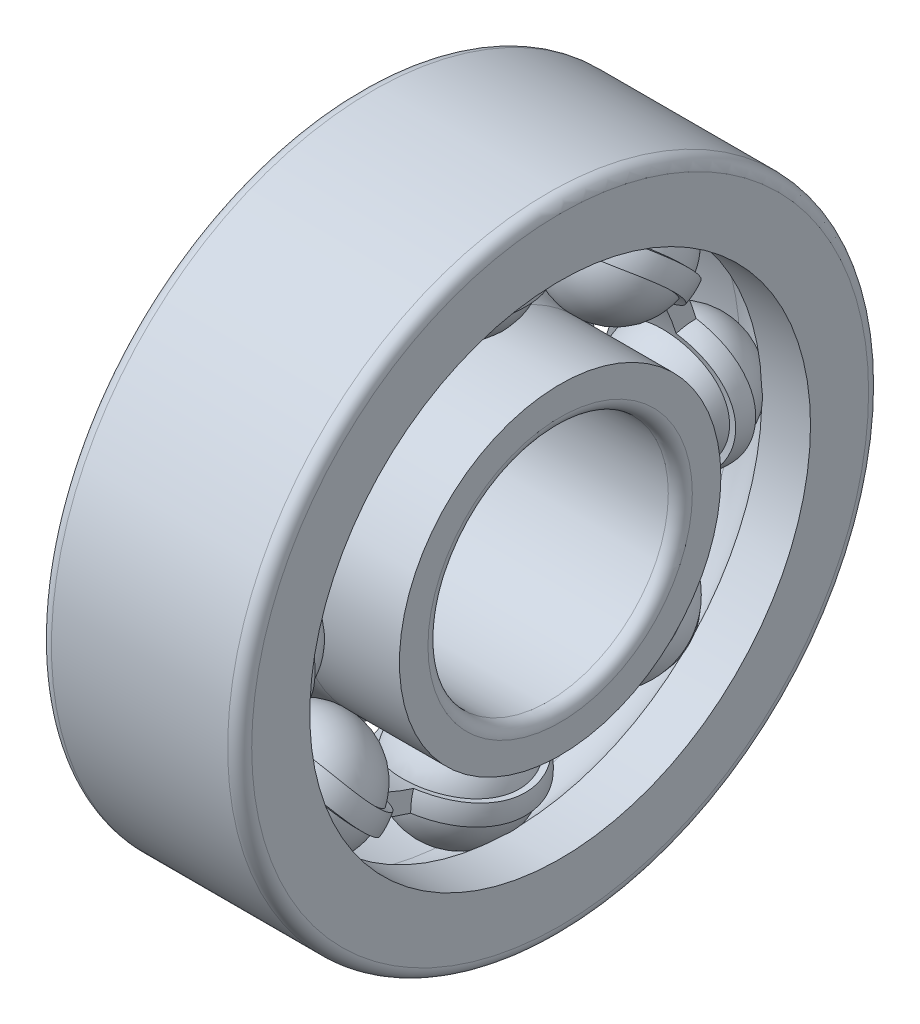
from build123d import *
from build123d.topology import SkipClean

# Parameters (mm, degrees)
CAGSPISKE_W          = 1.5
CAGSPISKE_H          = 1
CAGEBALLS_COUNT      = 8
CAGEBALLS_ANGLE      = 315
CAGTRMODSKE_W        = 6.602
CAGTRMODSKE_H        = 2.801
CAGETRIMID_START     = -3.3
CAGETRIMID_OUTLINE_R = 10.5
CAGETRIMID_DEPTH     = 6.6
BALLSDETAILED_COUNT  = 8
BALLSDETAILED_ANGLE  = 315


with BuildPart() as part:
    # CagSpiSke → CageSpine (revolve)
    with BuildSketch(Plane.XY, mode=Mode.PRIVATE) as cagespine_sk:
        with Locations((0, 11)):
            Rectangle(CAGSPISKE_W, CAGSPISKE_H)
    revolve(cagespine_sk.sketch.rotate(Axis((-20.6375, 0, 0), (1, 0, 0)), 90), axis=Axis((-20.6375, 0, 0), (1, 0, 0)))

    # CagBalSke → CageBall (revolve)
    with BuildSketch(Plane.XY):
        with BuildLine():
            Line((-3.3, 11), (3.3, 11))
            ThreePointArc((3.3, 11), (0, 7.7), (-3.3, 11))
        make_face()
    cageball = revolve(axis=Axis((-1.905, 11, 0), (1, 0, 0)))

    # CageBalls: CageBall ×8 about axis
    cageballs_axis = Axis((-50, 0, 0), (1, 0, 0))
    for i in range(1, CAGEBALLS_COUNT):
        add(cageball.rotate(cageballs_axis, i * CAGEBALLS_ANGLE / (CAGEBALLS_COUNT - 1)))

    # CagTrmODSke → CageTrimOD (revolve, cut)
    with SkipClean():  # the faces are left unmerged after this step: merging them gives an invalid solid
        with BuildSketch(Plane.XY, mode=Mode.PRIVATE) as cagetrimod_sk:
            with Locations((0, 12.9005)):
                Rectangle(CAGTRMODSKE_W, CAGTRMODSKE_H)
        revolve(cagetrimod_sk.sketch.rotate(Axis((-20.6375, 0, 0), (1, 0, 0)), 73.774204952), axis=Axis((-20.6375, 0, 0), (1, 0, 0)), mode=Mode.SUBTRACT)

    # CageTrimID: read off the stored shape, not the designer's step
    # CageTrimID outline → CageTrimID (cut)
    with SkipClean():  # the faces are left unmerged after this step: merging them gives an invalid solid
        with BuildSketch(Plane.YZ.offset(CAGETRIMID_START)):
            Circle(CAGETRIMID_OUTLINE_R)
        extrude(amount=CAGETRIMID_DEPTH, mode=Mode.SUBTRACT)

    # BalDetSke → BallDetailed (revolve)
    with SkipClean():  # the faces are left unmerged after this step: merging them gives an invalid solid
        with BuildSketch(Plane.XY):
            with BuildLine():
                Line((-3, 11), (3, 11))
                ThreePointArc((3, 11), (0, 8), (-3, 11))
            make_face()
        balldetailed = revolve(axis=Axis((-1.905, 11, 0), (1, 0, 0)))

    # InnRacSke → InnerRace (revolve)
    with SkipClean():  # the faces are left unmerged after this step: merging them gives an invalid solid
        with BuildSketch(Plane.XY, mode=Mode.PRIVATE) as innerrace_sk:
            with BuildLine():
                Line((-2.569168153, 9.5), (-5, 9.5))
                Line((-5, 9.5), (-5, 6.6))
                ThreePointArc((-5, 6.6), (-4.824264069, 6.175735931), (-4.4, 6))
                Line((-4.4, 6), (4.4, 6))
                ThreePointArc((4.4, 6), (4.824264069, 6.175735931), (5, 6.6))
                Line((5, 6.6), (5, 8.025))
                Line((5, 8.025), (0, 8.025))
                ThreePointArc((0, 8.025), (-1.481236814, 8.419968508), (-2.569168153, 9.5))
            make_face()
        revolve(innerrace_sk.sketch.rotate(Axis((-20.6375, 0, 0), (1, 0, 0)), 270), axis=Axis((-20.6375, 0, 0), (1, 0, 0)))

    # OutRacSke → OuterRace (revolve)
    with SkipClean():  # the faces are left unmerged after this step: merging them gives an invalid solid
        with BuildSketch(Plane.XY, mode=Mode.PRIVATE) as outerrace_sk:
            with BuildLine():
                Line((0, 13.975), (-5, 13.975))
                Line((-5, 13.975), (-5, 15.4))
                ThreePointArc((-5, 15.4), (-4.824264069, 15.824264069), (-4.4, 16))
                Line((-4.4, 16), (4.4, 16))
                ThreePointArc((4.4, 16), (4.824264069, 15.824264069), (5, 15.4))
                Line((5, 15.4), (5, 12.5))
                Line((5, 12.5), (2.569168153, 12.5))
                ThreePointArc((2.569168153, 12.5), (1.481236814, 13.580031492), (0, 13.975))
            make_face()
        revolve(outerrace_sk.sketch.rotate(Axis((-20.6375, 0, 0), (1, 0, 0)), 270), axis=Axis((-20.6375, 0, 0), (1, 0, 0)))

    # BallsDetailed: BallDetailed ×8 about axis
    with SkipClean():  # the faces are left unmerged after this step: merging them gives an invalid solid
        ballsdetailed_axis = Axis((-50, 0, 0), (1, 0, 0))
        for i in range(1, BALLSDETAILED_COUNT):
            add(balldetailed.rotate(ballsdetailed_axis, i * BALLSDETAILED_ANGLE / (BALLSDETAILED_COUNT - 1)))


solid = part.part
